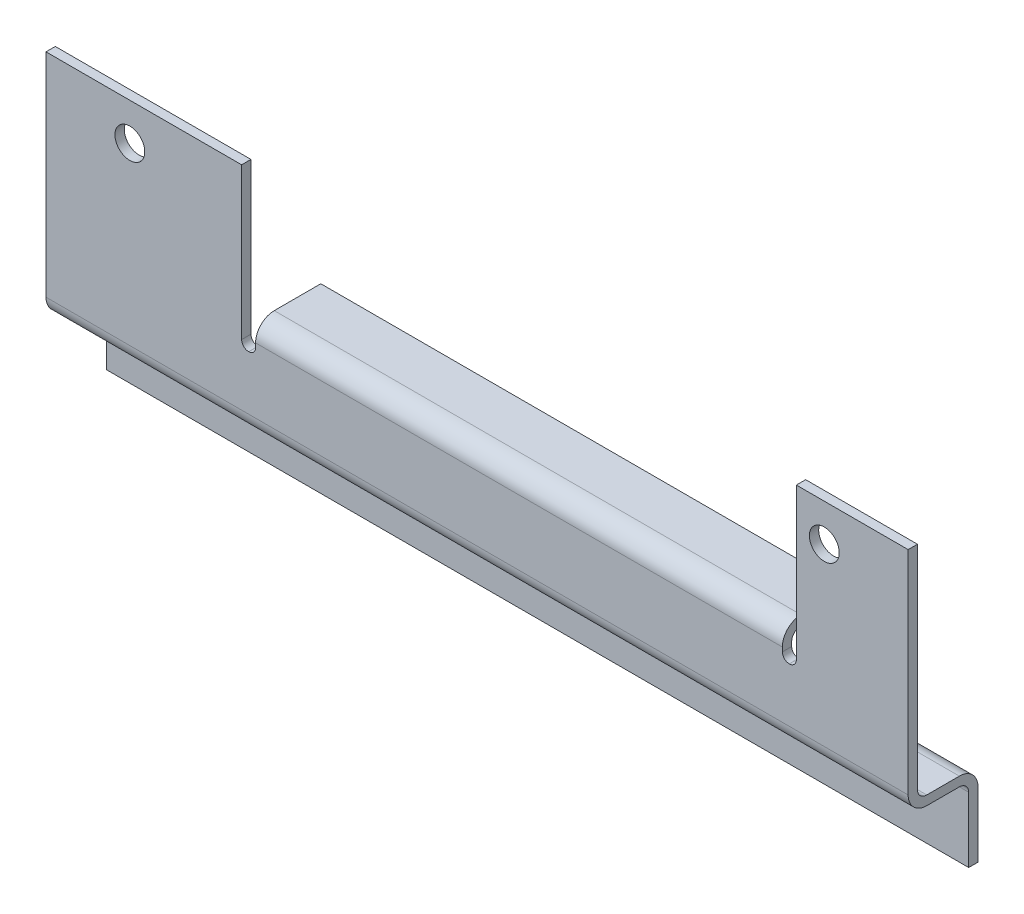
from build123d import *

# Parameters (mm, degrees)
ESQUISSE1_R             = 1.6
EXTRUSION1_DEPTH        = 1
ESQUISSE2_W             = 59.55
ESQUISSE2_H             = 1
EXTRUSION2_DEPTH        = 7
ESQUISSE3_W             = 92.55
ESQUISSE3_H             = 1
EXTRUSION3_DEPTH        = 7.5
ESQUISSE4_W             = 92.55
ESQUISSE4_H             = 1
EXTRUSION4_DEPTH        = 8
CONG_1_R                = 1
CONG_2_R                = 2
CONG_3_R                = 1
CONG_4_R                = 2
ESQUISSE5_W             = 1.5
ESQUISSE5_H             = 17
ENL_V_MAT_EXTRU_1_DEPTH = 10
CONG_5_R                = 0.75
CONG_6_R                = 0.74
CONG_7_R                = 0.74
CONG_8_R                = 0.75


with BuildPart() as part:
    # Esquisse1 → Extrusion1 (new body)
    with BuildSketch(Plane.XY):
        Polygon((-46.275, -25.41), (-25.275, -25.41), (-25.275, -39.22), (34.275, -39.22), (34.275, -25.41), (46.275, -25.41), (46.275, -49.22), (-46.275, -49.22), align=None)
        with Locations((37.275, -29.41)):
            Circle(ESQUISSE1_R, mode=Mode.SUBTRACT)
        with Locations((-37.275, -29.41)):
            Circle(ESQUISSE1_R, mode=Mode.SUBTRACT)
    extrude(amount=EXTRUSION1_DEPTH)

    # Esquisse2 → Extrusion2 (add)
    with BuildSketch(Plane.XY.offset(1)):
        with Locations((4.5, -39.72)):
            Rectangle(ESQUISSE2_W, ESQUISSE2_H)
    extrude(amount=-EXTRUSION2_DEPTH)

    # Esquisse3 → Extrusion3 (add)
    with BuildSketch(Plane.XY.offset(1)):
        with Locations((0, -49.72)):
            Rectangle(ESQUISSE3_W, ESQUISSE3_H)
    extrude(amount=-EXTRUSION3_DEPTH)

    # Esquisse4 → Extrusion4 (add)
    with BuildSketch(Plane.XZ.offset(50.22)):
        with Locations((0, -6)):
            Rectangle(ESQUISSE4_W, ESQUISSE4_H)
    extrude(amount=EXTRUSION4_DEPTH)

    # Congé1
    cong_1_edges = [part.edges().sort_by_distance(p)[0] for p in [
        (0, -50.22, -5.5),
        (0, -49.22, 0),
    ]]
    fillet(cong_1_edges, radius=CONG_1_R)

    # Congé2
    cong_2_edges = [part.edges().sort_by_distance(p)[0] for p in [
        (0, -49.22, -6.5),
        (0, -50.22, 1),
    ]]
    fillet(cong_2_edges, radius=CONG_2_R)

    # Congé3
    cong_3_edges = [part.edges().sort_by_distance(p)[0] for p in [
        (4.5, -40.22, 0),
    ]]
    fillet(cong_3_edges, radius=CONG_3_R)

    # Congé4
    # the kernel refuses this fillet: 2 mm, written as the material it takes off along each edge
    with BuildSketch(Plane(origin=(-25.275, -39.22, 1), x_dir=(0, -1, 0), z_dir=(1, 0, 0))) as cong_4_piece_1:
        with BuildLine():
            CenterArc((CONG_4_R, CONG_4_R), CONG_4_R, 180, 90)
            Line((0, CONG_4_R), (0, 0))
            Line((0, 0), (CONG_4_R, 0))
        make_face()
    extrude(amount=59.55, mode=Mode.SUBTRACT)

    # Esquisse5 → Enlèv. mat.-Extru.1 (cut)
    with BuildSketch(Plane.XY.offset(1)):
        with Locations((-24.525, -33.91)):
            Rectangle(ESQUISSE5_W, ESQUISSE5_H)
        with Locations((33.525, -33.91)):
            Rectangle(ESQUISSE5_W, ESQUISSE5_H)
    extrude(amount=-ENL_V_MAT_EXTRU_1_DEPTH, mode=Mode.SUBTRACT)

    # Congé5
    cong_5_edges = [part.edges().sort_by_distance(p)[0] for p in [
        (-25.275, -42.41, 0.5),
    ]]
    fillet(cong_5_edges, radius=CONG_5_R)

    # Congé6
    cong_6_edges = [part.edges().sort_by_distance(p)[0] for p in [
        (-23.775, -42.41, 0.5),
    ]]
    fillet(cong_6_edges, radius=CONG_6_R)

    # Congé7
    cong_7_edges = [part.edges().sort_by_distance(p)[0] for p in [
        (32.775, -42.41, 0.5),
    ]]
    fillet(cong_7_edges, radius=CONG_7_R)

    # Congé8
    cong_8_edges = [part.edges().sort_by_distance(p)[0] for p in [
        (34.275, -42.41, 0.5),
    ]]
    fillet(cong_8_edges, radius=CONG_8_R)


solid = part.part
